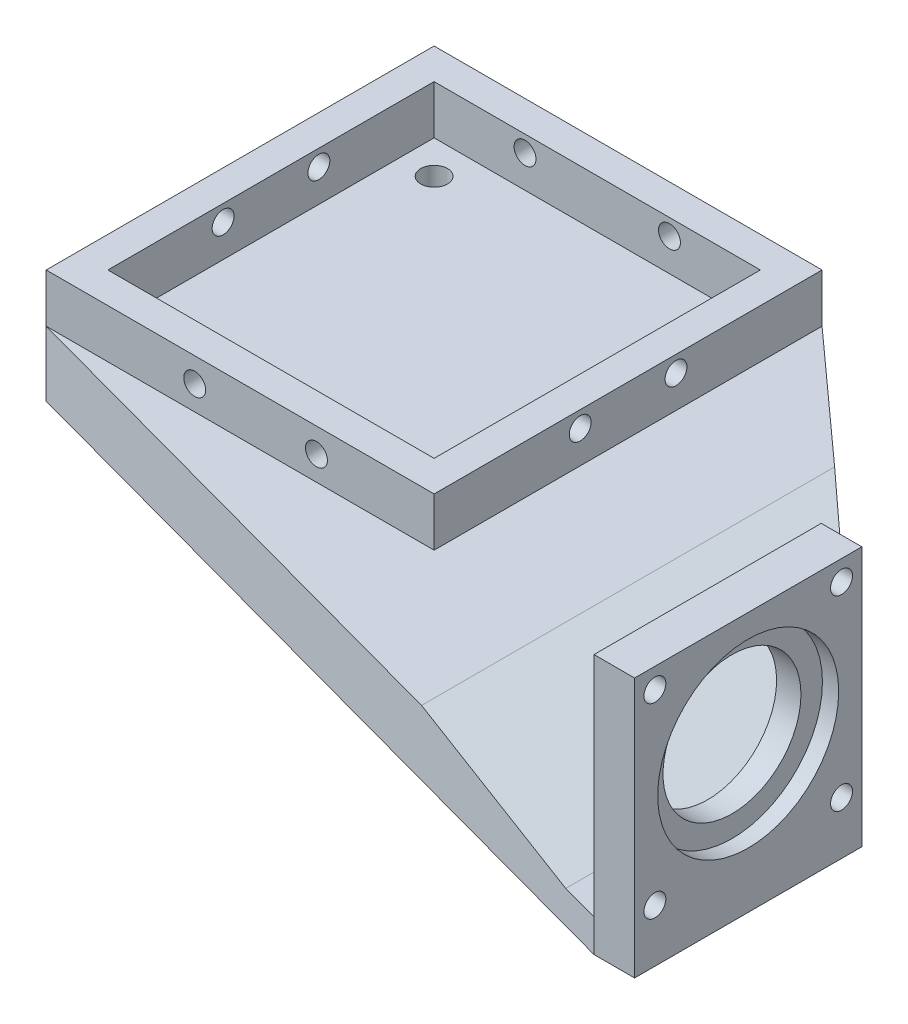
from build123d import *

# Parameters (mm, degrees)
SKETCH1_W            = 47.8
SKETCH1_H            = 47.8
SKETCH1_W_2          = 40.2
SKETCH1_H_2          = 40.2
BOSS_EXTRUDE1_DEPTH  = 6
CUT_EXTRUDE4_REACH   = 55.778
SKETCH6_R            = 1.35
CUT_EXTRUDE5_REACH   = 55.778
SKETCH7_R            = 1.35
SKETCH8_R            = 1.35
CUT_EXTRUDE6_DEPTH   = 54.777783517
SKETCH11_R           = 1.65
BOSS_EXTRUDE8_DEPTH  = 8
CUT_EXTRUDE7_DEPTH   = 105.25363303
SKETCH12_W           = 28
SKETCH12_H           = 28
SKETCH12_R           = 11.15
SKETCH12_R_2         = 1.35
BOSS_EXTRUDE9_DEPTH  = 5
BOSS_EXTRUDE10_START = -2
SKETCH12_3_R         = 11.15
SKETCH12_3_R_2       = 8.5
BOSS_EXTRUDE10_DEPTH = 3


with BuildPart() as part:
    # Sketch1 → Boss-Extrude1 (new body)
    with BuildSketch(Plane(origin=(0, 0, 0), x_dir=(1, 0, 0), z_dir=(0, 1, 0))):
        Rectangle(SKETCH1_W, SKETCH1_H)
        Rectangle(SKETCH1_W_2, SKETCH1_H_2, mode=Mode.SUBTRACT)
    extrude(amount=BOSS_EXTRUDE1_DEPTH)

    # Sketch6 → Cut-Extrude4 (cut, up to next)
    with BuildSketch(Plane(origin=(0, 0, -23.9), x_dir=(-1, 0, 0), z_dir=(0, 0, -1)), mode=Mode.PRIVATE) as cut_extrude4_sk1:
        with Locations((-8.9, 4)):
            Circle(SKETCH6_R)
    cut_extrude4_tool1 = extrude(cut_extrude4_sk1.sketch, amount=-CUT_EXTRUDE4_REACH, mode=Mode.PRIVATE) & part.part
    # Sketch6 → Cut-Extrude4 (cut, up to next)
    with BuildSketch(Plane(origin=(0, 0, -23.9), x_dir=(-1, 0, 0), z_dir=(0, 0, -1)), mode=Mode.PRIVATE) as cut_extrude4_sk2:
        with Locations((8.9, 4)):
            Circle(SKETCH6_R)
    cut_extrude4_tool2 = extrude(cut_extrude4_sk2.sketch, amount=-CUT_EXTRUDE4_REACH, mode=Mode.PRIVATE) & part.part
    add(cut_extrude4_tool1.solids().sort_by_distance((8.9, 4, -23.9))[0], mode=Mode.SUBTRACT)
    add(cut_extrude4_tool2.solids().sort_by_distance((-8.9, 4, -23.9))[0], mode=Mode.SUBTRACT)

    # Sketch7 → Cut-Extrude5 (cut, up to next)
    with BuildSketch(Plane.XY.offset(23.9), mode=Mode.PRIVATE) as cut_extrude5_sk1:
        with Locations((9.4, 3)):
            Circle(SKETCH7_R)
    cut_extrude5_tool1 = extrude(cut_extrude5_sk1.sketch, amount=-CUT_EXTRUDE5_REACH, mode=Mode.PRIVATE) & part.part
    # Sketch7 → Cut-Extrude5 (cut, up to next)
    with BuildSketch(Plane.XY.offset(23.9), mode=Mode.PRIVATE) as cut_extrude5_sk2:
        with Locations((-5.6, 3)):
            Circle(SKETCH7_R)
    cut_extrude5_tool2 = extrude(cut_extrude5_sk2.sketch, amount=-CUT_EXTRUDE5_REACH, mode=Mode.PRIVATE) & part.part
    add(cut_extrude5_tool1.solids().sort_by_distance((9.4, 3, 23.9))[0], mode=Mode.SUBTRACT)
    add(cut_extrude5_tool2.solids().sort_by_distance((-5.6, 3, 23.9))[0], mode=Mode.SUBTRACT)

    # Sketch8 → Cut-Extrude6 (cut, through all)
    with BuildSketch(Plane(origin=(23.9, 0, 0), x_dir=(0, 0, -1), z_dir=(1, 0, 0))):
        with Locations((-5.9, 4)):
            Circle(SKETCH8_R)
        with Locations((5.9, 4)):
            Circle(SKETCH8_R)
    extrude(amount=-CUT_EXTRUDE6_DEPTH, mode=Mode.SUBTRACT)

    # Sketch11 → Boss-Extrude8 (add)
    with BuildSketch(Plane(origin=(0, 0, 0), x_dir=(1, 0, 0), z_dir=(0, 1, 0))):
        Polygon((73.9, -49.2), (73.9, -21.2), (23.9, 23.9), (-23.9, 23.9), (-23.9, -23.9), (68.9, -49.2), align=None)
        with Locations((16, 16)):
            Circle(SKETCH11_R, mode=Mode.SUBTRACT)
        with Locations((-16, 16)):
            Circle(SKETCH11_R, mode=Mode.SUBTRACT)
        with Locations((-16, -16)):
            Circle(SKETCH11_R, mode=Mode.SUBTRACT)
        with Locations((16, -16)):
            Circle(SKETCH11_R, mode=Mode.SUBTRACT)
    extrude(amount=-BOSS_EXTRUDE8_DEPTH)

    # Sketch13 → Cut-Extrude7 (cut, through all)
    with BuildSketch(Plane.XY.offset(49.2)):
        Polygon((73.9, -3.987183479), (64.114380232, -3.987183479), (28.73812358, 1.78739259), (73.9, 1.78739259), align=None)
    extrude(amount=-CUT_EXTRUDE7_DEPTH, mode=Mode.SUBTRACT)

    # Sketch12 → Boss-Extrude9 (add)
    with BuildSketch(Plane(origin=(73.9, 0, 0), x_dir=(0, 0, -1), z_dir=(1, 0, 0))):
        with Locations((-35.2, 10.012816521)):
            Rectangle(SKETCH12_W, SKETCH12_H)
        with Locations((-35.2, 10.012816521)):
            Circle(SKETCH12_R, mode=Mode.SUBTRACT)
        with Locations((-46.7, -1.487183479)):
            Circle(SKETCH12_R_2, mode=Mode.SUBTRACT)
        with Locations((-23.7, -1.487183479)):
            Circle(SKETCH12_R_2, mode=Mode.SUBTRACT)
        with Locations((-46.7, 21.512816521)):
            Circle(SKETCH12_R_2, mode=Mode.SUBTRACT)
        with Locations((-23.7, 21.512816521)):
            Circle(SKETCH12_R_2, mode=Mode.SUBTRACT)
    extrude(amount=-BOSS_EXTRUDE9_DEPTH)

    # Sketch12<3> → Boss-Extrude10 (add)
    with BuildSketch(Plane(origin=(73.9, 0, 0), x_dir=(0, 0, -1), z_dir=(1, 0, 0)).offset(BOSS_EXTRUDE10_START)):
        with Locations((-35.2, 10.012816521)):
            Circle(SKETCH12_3_R)
        with Locations((-35.2, 10.012816521)):
            Circle(SKETCH12_3_R_2, mode=Mode.SUBTRACT)
    extrude(amount=-BOSS_EXTRUDE10_DEPTH)


solid = part.part
